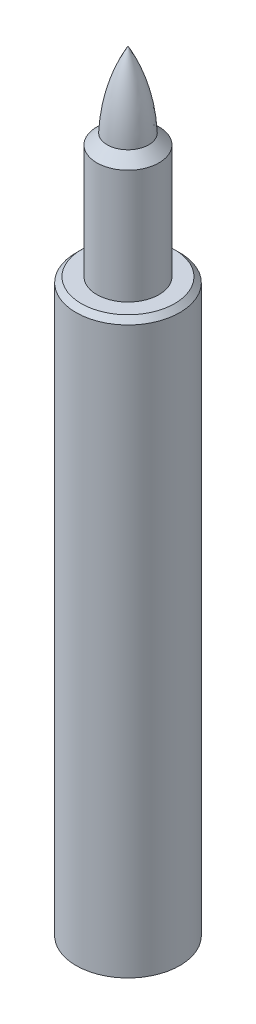
from build123d import *

# Parameters (mm, degrees)
SKETCH1_R           = 10
BOSS_EXTRUDE1_DEPTH = 110
SKETCH2_R           = 6
BOSS_EXTRUDE2_DEPTH = 24
CHAMFER1_SIZE       = 2
CHAMFER2_SIZE       = 1


with BuildPart() as part:
    # Sketch1 → Boss-Extrude1 (new body)
    with BuildSketch(Plane(origin=(0, 0, 0), x_dir=(1, 0, 0), z_dir=(0, 1, 0))):
        with Locations(Location((0, 0, 0), (0, 0, 270))):
            Circle(SKETCH1_R)
    extrude(amount=BOSS_EXTRUDE1_DEPTH)

    # Sketch2 → Boss-Extrude2 (add)
    with BuildSketch(Plane(origin=(0, 110, 0), x_dir=(1, 0, 0), z_dir=(0, 1, 0))):
        with Locations(Location((0, 0, 0), (0, 0, 270))):
            Circle(SKETCH2_R)
    extrude(amount=BOSS_EXTRUDE2_DEPTH)

    # Sketch3 → Revolve1 (revolve)
    with BuildSketch(Plane(origin=(0, 0, 0), x_dir=(0, 0, -1), z_dir=(1, 0, 0))):
        with BuildLine():
            Line((0, 134), (0, 148.5))
            add(Edge.make_bspline(
                [(0, 148.5), (-3.667360113, 141.867546182), (-4, 134)],
                knots=[0, 0, 0, 1, 1, 1], degree=2))
            Line((-4, 134), (0, 134))
        make_face()
    revolve(axis=Axis((0, 134, 0), (0, -1, 0)))

    # Chamfer1
    chamfer1_edges = [part.edges().sort_by_distance(p)[0] for p in [
        (0, 134, -6),
    ]]
    chamfer(chamfer1_edges, length=CHAMFER1_SIZE - 0.0001)  # a hair under: the kernel refuses the full size

    # Chamfer2
    chamfer2_edges = [part.edges().sort_by_distance(p)[0] for p in [
        (0, 110, -10),
    ]]
    chamfer(chamfer2_edges, length=CHAMFER2_SIZE)


solid = part.part
